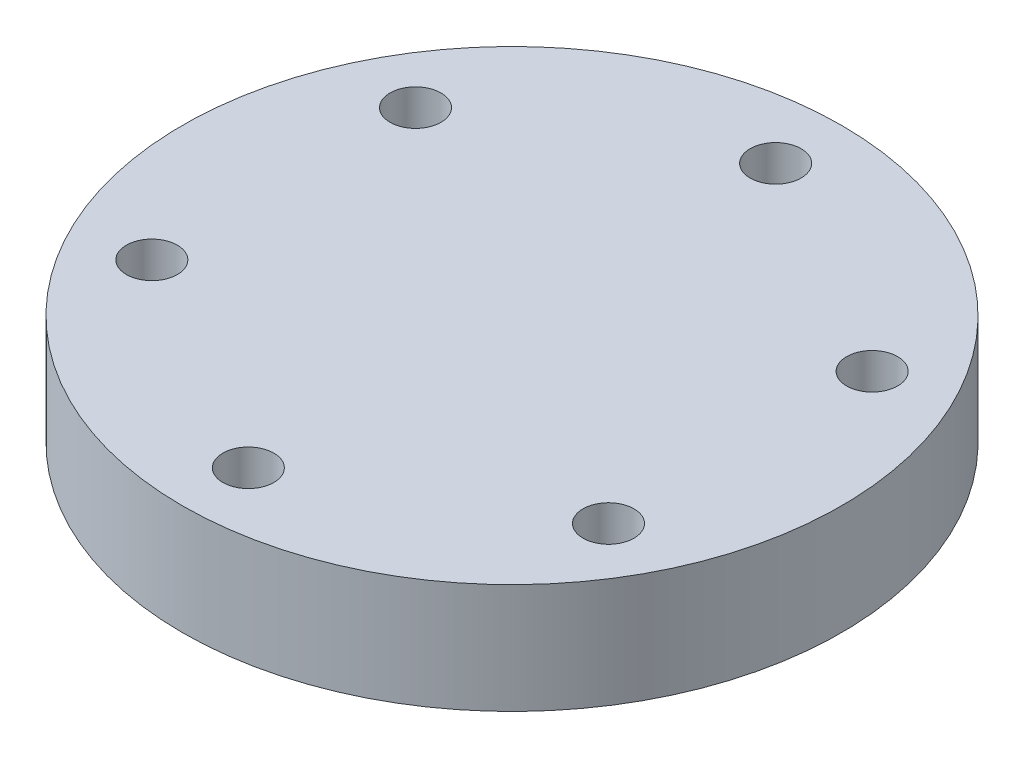
from build123d import *

# Parameters (mm, degrees)
OUTER_R                     = 19.05
BODY_DEPTH                  = 6.35
INNER_R                     = 11.6205
POCKET_DEPTH                = 3.175
F_32_0_116_DIAMETER_HOLE1_D = 2.9464
SCREW_HOLES_COUNT           = 6


with BuildPart() as part:
    # outer → Body (new body)
    with BuildSketch(Plane(origin=(0, 0, 0), x_dir=(1, 0, 0), z_dir=(0, 1, 0))):
        Circle(OUTER_R)
    extrude(amount=BODY_DEPTH)

    # inner → Pocket (cut)
    with BuildSketch(Plane(origin=(0, 0, 0), x_dir=(1, 0, 0), z_dir=(0, 1, 0))):
        Circle(INNER_R)
    extrude(amount=POCKET_DEPTH, mode=Mode.SUBTRACT)

    # #32 (0.116) Diameter Hole1 (through all)
    with Locations(Plane(origin=(0, 6.35, 0), x_dir=(1, 0, 0), z_dir=(0, 1, 0))):
        with Locations((0, 15.24)):
            f_32_0_116_diameter_hole1 = Hole(F_32_0_116_DIAMETER_HOLE1_D / 2)

    # Screw Holes: #32 (0.116) Diameter Hole1 ×6 about axis
    screw_holes_axis = Axis((0, 6.6675, 0), (0, -1, 0))
    for i in range(1, SCREW_HOLES_COUNT):
        add(f_32_0_116_diameter_hole1.rotate(screw_holes_axis, i * 360 / SCREW_HOLES_COUNT), mode=Mode.SUBTRACT)


solid = part.part
